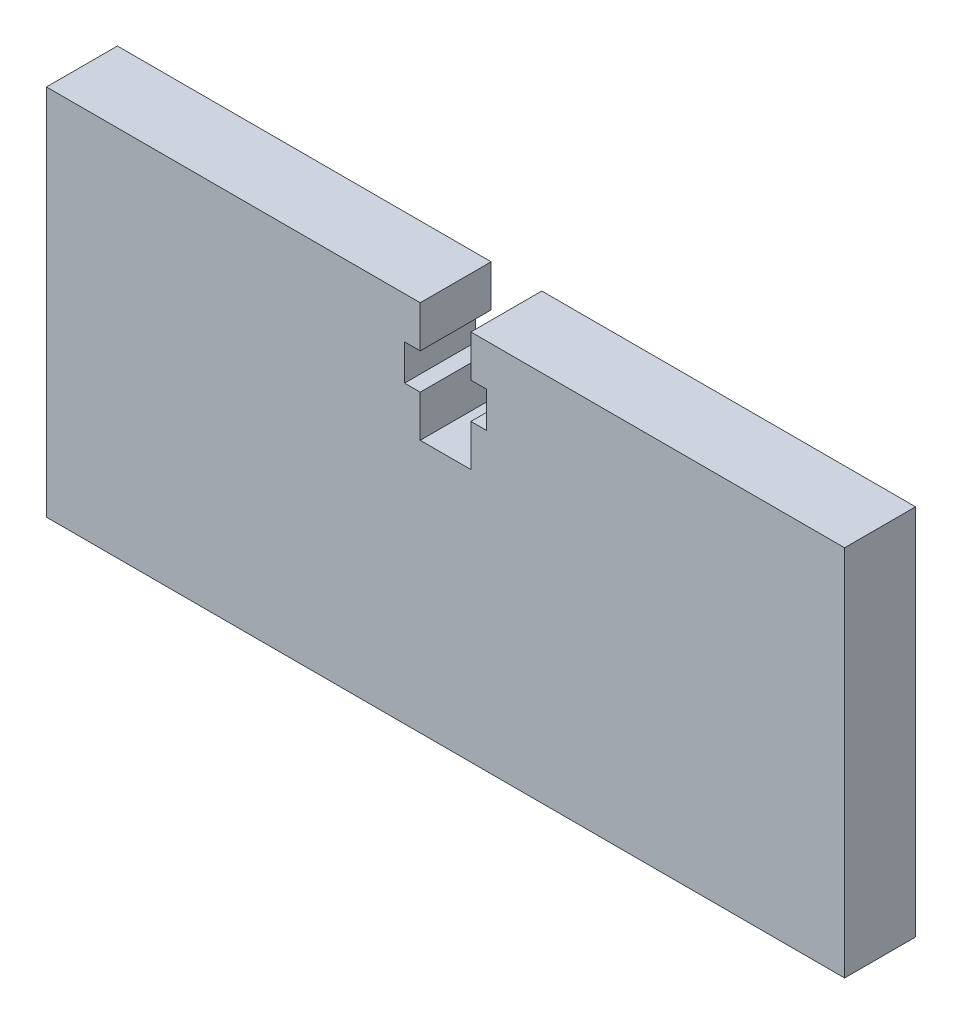
from build123d import *

# Parameters (mm, degrees)
BOSS_EXTRUDE1_DEPTH = 4.7625


with BuildPart() as part:
    # Sketch1 → Boss-Extrude1 (new body)
    with BuildSketch(Plane.XY):
        Polygon((-26.797, 16.51), (-26.797, -8.51), (26.797, -8.51), (26.797, 16.51), (1.7, 16.51), (1.7, 13.71), (2.75, 13.71), (2.75, 11.31), (1.7, 11.31), (1.7, 8.51), (-1.7, 8.51), (-1.7, 11.31), (-2.75, 11.31), (-2.75, 13.71), (-1.7, 13.71), (-1.7, 16.51), align=None)
    extrude(amount=BOSS_EXTRUDE1_DEPTH)


solid = part.part
